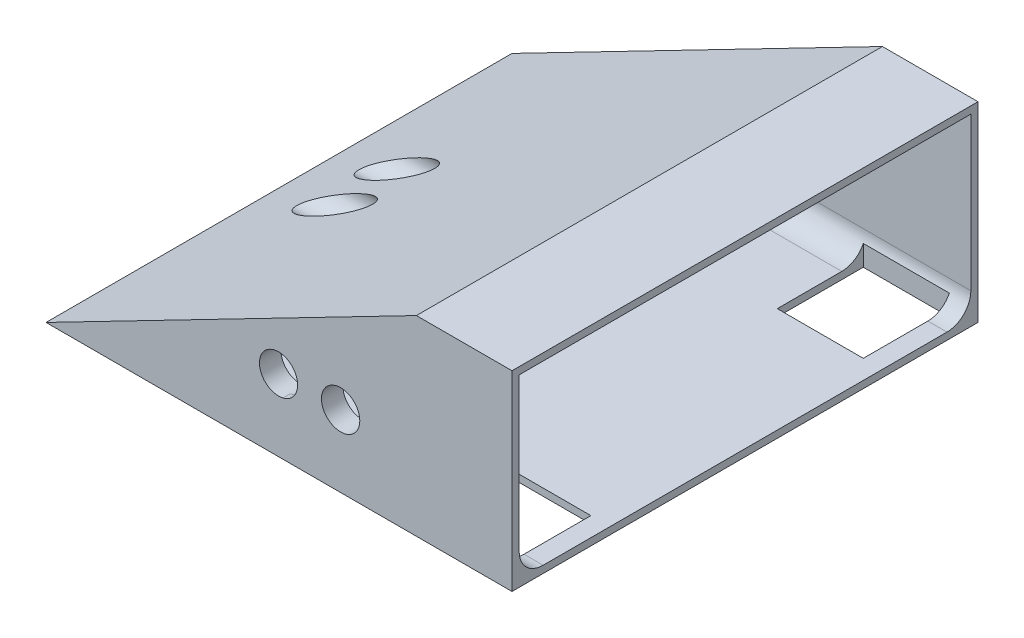
from build123d import *

# Parameters (mm, degrees)
ROBOT_DEPTH                 = 195
VACIO_POR_DENTRO_3MM_T      = -3
SKETCH3_R                   = 8.02
ULTRASONICO_DERECHA_DEPTH   = 3
SKETCH9_R                   = 8.2
ULTRASONICO_IZQUIERDA_DEPTH = 3
SKETCH10_W                  = 37
SKETCH10_H                  = 37
RUEDA_DERECHA_DEPTH         = 3
SKETCH12_W                  = 36
SKETCH12_H                  = 36
RUEDA_IZQUIERDA_DEPTH       = 3
SKETCH14_W                  = 7.1
SKETCH14_H                  = 7.1
CYN70_DERECHA_DEPTH         = 4
SKETCH15_W                  = 7.1
SKETCH15_H                  = 7.1
CNY70_CENTRO_DEPTH          = 4
SKETCH13_W                  = 7.1
SKETCH13_H                  = 7.1
CNY70_IZQUIERDA_DEPTH       = 4
ULTRASONICO_CENTRO_R        = 8.7
CUT_EXTRUDE4_DEPTH          = 75
FILLET2_R                   = 10
SKETCH16_R                  = 8.685660505
SKETCH16_R_2                = 8.02
BOSS_EXTRUDE1_DEPTH         = 9
SKETCH18_R                  = 8.7
SKETCH18_R_2                = 8.2
SKETCH18_R_3                = 8.719213476
BOSS_EXTRUDE2_DEPTH         = 60
SKETCH23_W                  = 76.592532913
SKETCH23_H                  = 65.967934853
CUT_EXTRUDE5_DEPTH          = 25


with BuildPart() as part:
    # Sketch2 → Robot (new body)
    with BuildSketch(Plane.XY):
        Polygon((0, 0), (195, 0), (195, 80), (155, 80), align=None)
    extrude(amount=ROBOT_DEPTH)

    # Vacio por dentro 3mm
    vacio_por_dentro_3mm_openings = [part.faces().sort_by_distance(p)[0] for p in [
        (195, 40, 97.5),
    ]]
    offset(amount=VACIO_POR_DENTRO_3MM_T, openings=vacio_por_dentro_3mm_openings, kind=Kind.INTERSECTION)

    # Sketch3 → Ultrasonico Derecha (cut)
    with BuildSketch(Plane.XY.offset(195)):
        with Locations((97.289863967, 30)):
            Circle(SKETCH3_R)
        with Locations((123.289863967, 30)):
            Circle(SKETCH3_R)
    extrude(amount=-ULTRASONICO_DERECHA_DEPTH, mode=Mode.SUBTRACT)

    # Sketch9 → Ultrasonico Izquierda (cut)
    with BuildSketch(Plane(origin=(0, 0, 0), x_dir=(-1, 0, 0), z_dir=(0, 0, -1))):
        with Locations((-97.284004153, 30)):
            Circle(SKETCH9_R)
        with Locations((-123.284004153, 30)):
            Circle(SKETCH9_R)
    extrude(amount=-ULTRASONICO_IZQUIERDA_DEPTH, mode=Mode.SUBTRACT)

    # Sketch10 → Rueda Derecha (cut)
    with BuildSketch(Plane(origin=(0, 0, 0), x_dir=(-1, 0, 0), z_dir=(0, -1, 0))):
        with Locations((-168.5, -172.5)):
            Rectangle(SKETCH10_W, SKETCH10_H)
    extrude(amount=-RUEDA_DERECHA_DEPTH, mode=Mode.SUBTRACT)

    # Sketch12 → Rueda Izquierda (cut)
    with BuildSketch(Plane(origin=(0, 0, 0), x_dir=(-1, 0, 0), z_dir=(0, -1, 0))):
        with Locations((-169, -22)):
            Rectangle(SKETCH12_W, SKETCH12_H)
    extrude(amount=-RUEDA_IZQUIERDA_DEPTH, mode=Mode.SUBTRACT)

    # Sketch14 → Cyn70 Derecha (cut)
    with BuildSketch(Plane(origin=(0, 0, 0), x_dir=(-1, 0, 0), z_dir=(0, -1, 0))):
        with Locations((-18.55, -183.45)):
            Rectangle(SKETCH14_W, SKETCH14_H)
    extrude(amount=-CYN70_DERECHA_DEPTH, mode=Mode.SUBTRACT)

    # Sketch15 → Cny70 Centro (cut)
    with BuildSketch(Plane(origin=(0, 0, 0), x_dir=(-1, 0, 0), z_dir=(0, -1, 0))):
        with Locations((-18.55, -97.5)):
            Rectangle(SKETCH15_W, SKETCH15_H)
    extrude(amount=-CNY70_CENTRO_DEPTH, mode=Mode.SUBTRACT)

    # Sketch13 → Cny70 Izquierda (cut)
    with BuildSketch(Plane.XZ):
        with Locations((18.55, 11.55)):
            Rectangle(SKETCH13_W, SKETCH13_H)
    extrude(amount=-CNY70_IZQUIERDA_DEPTH, mode=Mode.SUBTRACT)

    # Ultrasonico Centro → Cut-Extrude4 (cut)
    with BuildSketch(Plane(origin=(0, 0, 0), x_dir=(0, 0, -1), z_dir=(1, 0, 0))):
        with Locations(Location((-85, 19, 0), (0, 0, 270))):
            Circle(ULTRASONICO_CENTRO_R)
        with Locations(Location((-111, 19, 0), (0, 0, 270))):
            Circle(ULTRASONICO_CENTRO_R)
    extrude(amount=CUT_EXTRUDE4_DEPTH, mode=Mode.SUBTRACT)

    # Fillet2
    # the kernel refuses this fillet: 10 mm, written as the material it adds along each edge
    with BuildSketch(Plane(origin=(-12.646463672, 3, 3), x_dir=(0, 0, 1), z_dir=(1, 0, 0))) as fillet2_piece_1_section:
        with BuildLine():
            CenterArc((FILLET2_R, -FILLET2_R), FILLET2_R, 90, 90)
            Line((0, -FILLET2_R), (0, 0))
            Line((0, 0), (FILLET2_R, 0))
        make_face()
    fillet2_piece_1 = extrude(amount=232.646463672, mode=Mode.PRIVATE)
    fillet2_piece_1 = split(fillet2_piece_1, bisect_by=Plane(origin=(15, 3.299966987, 9.404706068), z_dir=(-1, 0, 0)), keep=Keep.TOP, mode=Mode.PRIVATE)
    fillet2_piece_1 = split(fillet2_piece_1, bisect_by=Plane(origin=(13.75014217, 3.720828822, 9.404706068), z_dir=(0.4586429197702524, -0.8886206570548638, 0)), keep=Keep.TOP, mode=Mode.PRIVATE)
    add(fillet2_piece_1)
    with BuildSketch(Plane(origin=(-12.646463672, 3, 3), x_dir=(0, 0, 1), z_dir=(1, 0, 0))) as fillet2_piece_2_section:
        with BuildLine():
            CenterArc((FILLET2_R, -FILLET2_R), FILLET2_R, 90, 90)
            Line((0, -FILLET2_R), (0, 0))
            Line((0, 0), (FILLET2_R, 0))
        make_face()
    fillet2_piece_2 = extrude(amount=232.646463672, mode=Mode.PRIVATE)
    fillet2_piece_2 = split(fillet2_piece_2, bisect_by=Plane(origin=(18.935979347, 4.386521826, 8), z_dir=(0, 0, -1)), keep=Keep.TOP, mode=Mode.PRIVATE)
    fillet2_piece_2 = split(fillet2_piece_2, bisect_by=Plane(origin=(151, 4.386521826, 5.724112509), z_dir=(-1, 0, 0)), keep=Keep.TOP, mode=Mode.PRIVATE)
    fillet2_piece_2 = split(fillet2_piece_2, bisect_by=Plane(origin=(18.116430796, 5.974397144, 5.724112509), z_dir=(0.4586429197702524, -0.8886206570548638, 0)), keep=Keep.TOP, mode=Mode.PRIVATE)
    add(fillet2_piece_2)
    with BuildSketch(Plane(origin=(-12.646463672, 3, 3), x_dir=(0, 0, 1), z_dir=(1, 0, 0))) as fillet2_piece_3_section:
        with BuildLine():
            CenterArc((FILLET2_R, -FILLET2_R), FILLET2_R, 90, 90)
            Line((0, -FILLET2_R), (0, 0))
            Line((0, 0), (FILLET2_R, 0))
        make_face()
    fillet2_piece_3 = extrude(amount=232.646463672, mode=Mode.PRIVATE)
    fillet2_piece_3 = split(fillet2_piece_3, bisect_by=Plane(origin=(22.1, 3.396845927, 9.232636126), z_dir=(1, 0, 0)), keep=Keep.TOP, mode=Mode.PRIVATE)
    fillet2_piece_3 = split(fillet2_piece_3, bisect_by=Plane(origin=(151, 3.396845927, 9.232636126), z_dir=(-1, 0, 0)), keep=Keep.TOP, mode=Mode.PRIVATE)
    fillet2_piece_3 = split(fillet2_piece_3, bisect_by=Plane(origin=(71.104265308, 33.322956893, 9.232636126), z_dir=(0.4586429197702524, -0.8886206570548638, 0)), keep=Keep.TOP, mode=Mode.PRIVATE)
    add(fillet2_piece_3)
    with BuildSketch(Plane(origin=(-12.646463672, 3, 3), x_dir=(0, 0, 1), z_dir=(1, 0, 0))) as fillet2_piece_4_section:
        with BuildLine():
            CenterArc((FILLET2_R, -FILLET2_R), FILLET2_R, 90, 90)
            Line((0, -FILLET2_R), (0, 0))
            Line((0, 0), (FILLET2_R, 0))
        make_face()
    fillet2_piece_4 = extrude(amount=207.646463672, mode=Mode.PRIVATE)
    fillet2_piece_4 = split(fillet2_piece_4, bisect_by=Plane(origin=(187, 3.396845927, 9.232636126), z_dir=(1, 0, 0)), keep=Keep.TOP, mode=Mode.PRIVATE)
    add(fillet2_piece_4)
    with BuildSketch(Plane(origin=(-12.646463672, 3, 3), x_dir=(0, 0, 1), z_dir=(1, 0, 0))) as fillet2_piece_5_section:
        with BuildLine():
            CenterArc((FILLET2_R, -FILLET2_R), FILLET2_R, 90, 90)
            Line((0, -FILLET2_R), (0, 0))
            Line((0, 0), (FILLET2_R, 0))
        make_face()
    fillet2_piece_5 = extrude(amount=232.646463672, mode=Mode.PRIVATE)
    fillet2_piece_5 = split(fillet2_piece_5, bisect_by=Plane(origin=(187, 6.605810426, 3.459165083), z_dir=(-1, 0, 0)), keep=Keep.TOP, mode=Mode.PRIVATE)
    fillet2_piece_5 = split(fillet2_piece_5, bisect_by=Plane(origin=(169, 6.605810426, 4), z_dir=(0, 0, -1)), keep=Keep.TOP, mode=Mode.PRIVATE)
    fillet2_piece_5 = split(fillet2_piece_5, bisect_by=Plane(origin=(137.518477626, 67.601260025, 3.459165083), z_dir=(0.4586429197702524, -0.8886206570548638, 0)), keep=Keep.TOP, mode=Mode.PRIVATE)
    add(fillet2_piece_5)
    with BuildSketch(Plane(origin=(-12.646463672, 3, 192), x_dir=(0, 0, -1), z_dir=(1, 0, 0))) as fillet2_piece_6_section:
        with BuildLine():
            CenterArc((FILLET2_R, FILLET2_R), FILLET2_R, 180, 90)
            Line((0, FILLET2_R), (0, 0))
            Line((0, 0), (FILLET2_R, 0))
        make_face()
    fillet2_piece_6 = extrude(amount=232.646463672, mode=Mode.PRIVATE)
    fillet2_piece_6 = split(fillet2_piece_6, bisect_by=Plane(origin=(15, 3.299966987, 185.595293932), z_dir=(-1, 0, 0)), keep=Keep.TOP, mode=Mode.PRIVATE)
    fillet2_piece_6 = split(fillet2_piece_6, bisect_by=Plane(origin=(13.75014217, 3.720828822, 185.595293932), z_dir=(0.4586429197702524, -0.8886206570548638, 0)), keep=Keep.TOP, mode=Mode.PRIVATE)
    add(fillet2_piece_6)
    with BuildSketch(Plane(origin=(-12.646463672, 3, 192), x_dir=(0, 0, -1), z_dir=(1, 0, 0))) as fillet2_piece_7_section:
        with BuildLine():
            CenterArc((FILLET2_R, FILLET2_R), FILLET2_R, 180, 90)
            Line((0, FILLET2_R), (0, 0))
            Line((0, 0), (FILLET2_R, 0))
        make_face()
    fillet2_piece_7 = extrude(amount=232.646463672, mode=Mode.PRIVATE)
    fillet2_piece_7 = split(fillet2_piece_7, bisect_by=Plane(origin=(18.935979347, 4.386521826, 187), z_dir=(0, 0, 1)), keep=Keep.TOP, mode=Mode.PRIVATE)
    fillet2_piece_7 = split(fillet2_piece_7, bisect_by=Plane(origin=(150, 4.386521826, 189.275887491), z_dir=(-1, 0, 0)), keep=Keep.TOP, mode=Mode.PRIVATE)
    fillet2_piece_7 = split(fillet2_piece_7, bisect_by=Plane(origin=(18.116430796, 5.974397144, 189.275887491), z_dir=(0.4586429197702524, -0.8886206570548638, 0)), keep=Keep.TOP, mode=Mode.PRIVATE)
    add(fillet2_piece_7)
    with BuildSketch(Plane(origin=(-12.646463672, 3, 192), x_dir=(0, 0, -1), z_dir=(1, 0, 0))) as fillet2_piece_8_section:
        with BuildLine():
            CenterArc((FILLET2_R, FILLET2_R), FILLET2_R, 180, 90)
            Line((0, FILLET2_R), (0, 0))
            Line((0, 0), (FILLET2_R, 0))
        make_face()
    fillet2_piece_8 = extrude(amount=232.646463672, mode=Mode.PRIVATE)
    fillet2_piece_8 = split(fillet2_piece_8, bisect_by=Plane(origin=(22.1, 3.396845927, 185.767363874), z_dir=(1, 0, 0)), keep=Keep.TOP, mode=Mode.PRIVATE)
    fillet2_piece_8 = split(fillet2_piece_8, bisect_by=Plane(origin=(150, 3.396845927, 185.767363874), z_dir=(-1, 0, 0)), keep=Keep.TOP, mode=Mode.PRIVATE)
    fillet2_piece_8 = split(fillet2_piece_8, bisect_by=Plane(origin=(70.709441972, 33.119177106, 185.767363874), z_dir=(0.4586429197702524, -0.8886206570548638, 0)), keep=Keep.TOP, mode=Mode.PRIVATE)
    add(fillet2_piece_8)
    with BuildSketch(Plane(origin=(-12.646463672, 3, 192), x_dir=(0, 0, -1), z_dir=(1, 0, 0))) as fillet2_piece_9_section:
        with BuildLine():
            CenterArc((FILLET2_R, FILLET2_R), FILLET2_R, 180, 90)
            Line((0, FILLET2_R), (0, 0))
            Line((0, 0), (FILLET2_R, 0))
        make_face()
    fillet2_piece_9 = extrude(amount=207.646463672, mode=Mode.PRIVATE)
    fillet2_piece_9 = split(fillet2_piece_9, bisect_by=Plane(origin=(187, 3.396845927, 185.767363874), z_dir=(1, 0, 0)), keep=Keep.TOP, mode=Mode.PRIVATE)
    add(fillet2_piece_9)
    with BuildSketch(Plane(origin=(-12.646463672, 3, 192), x_dir=(0, 0, -1), z_dir=(1, 0, 0))) as fillet2_piece_10_section:
        with BuildLine():
            CenterArc((FILLET2_R, FILLET2_R), FILLET2_R, 180, 90)
            Line((0, FILLET2_R), (0, 0))
            Line((0, 0), (FILLET2_R, 0))
        make_face()
    fillet2_piece_10 = extrude(amount=232.646463672, mode=Mode.PRIVATE)
    fillet2_piece_10 = split(fillet2_piece_10, bisect_by=Plane(origin=(187, 6.605810426, 191.540834917), z_dir=(-1, 0, 0)), keep=Keep.TOP, mode=Mode.PRIVATE)
    fillet2_piece_10 = split(fillet2_piece_10, bisect_by=Plane(origin=(168.5, 6.605810426, 191), z_dir=(0, 0, 1)), keep=Keep.TOP, mode=Mode.PRIVATE)
    fillet2_piece_10 = split(fillet2_piece_10, bisect_by=Plane(origin=(137.12365429, 67.397480238, 191.540834917), z_dir=(0.4586429197702524, -0.8886206570548638, 0)), keep=Keep.TOP, mode=Mode.PRIVATE)
    add(fillet2_piece_10)

    # Sketch16 → Boss-Extrude1 (add)
    # profile 1 of 2: a face of its own
    with BuildSketch(Plane.XY.offset(195)):
        with Locations((123.289863967, 30)):
            Circle(SKETCH16_R)
        with Locations((123.289863967, 30)):
            Circle(SKETCH16_R_2, mode=Mode.SUBTRACT)
    # profile 2 of 2: a face of its own
    with BuildSketch(Plane.XY.offset(195)):
        with Locations((97.335124092, 30.010684101)):
            Circle(SKETCH16_R)
        with Locations((97.335124092, 30.010684101)):
            Circle(SKETCH16_R_2, mode=Mode.SUBTRACT)
    boss_extrude1 = extrude(amount=-BOSS_EXTRUDE1_DEPTH)

    # Mirror1: Boss-Extrude1 across plane
    add(boss_extrude1.mirror(Plane.XY.offset(97.5)))

    # Sketch18 → Boss-Extrude2 (add)
    # profile 1 of 2: a face of its own
    with BuildSketch(Plane(origin=(1, 0, 0), x_dir=(0, 0, -1), z_dir=(1, 0, 0))):
        with Locations(Location((-85, 19, 0), (0, 0, 270))):
            Circle(SKETCH18_R)
        with Locations((-85, 19)):
            Circle(SKETCH18_R_2, mode=Mode.SUBTRACT)
    # profile 2 of 2: a face of its own
    with BuildSketch(Plane(origin=(1, 0, 0), x_dir=(0, 0, -1), z_dir=(1, 0, 0))):
        with Locations(Location((-111, 19, 0), (0, 0, 270))):
            Circle(SKETCH18_R_3)
        with Locations((-111, 19)):
            Circle(SKETCH18_R_2, mode=Mode.SUBTRACT)
    extrude(amount=BOSS_EXTRUDE2_DEPTH)

    # Sketch23 → Cut-Extrude5 (cut)
    with BuildSketch(Plane(origin=(0, 0, 0), x_dir=(0.8886206570548638, 0.45864291977025234, 0), z_dir=(-0.4586429197702524, 0.8886206570548639, 0))):
        with Locations((38.296266456, -97.30278137)):
            Rectangle(SKETCH23_W, SKETCH23_H)
    extrude(amount=CUT_EXTRUDE5_DEPTH, mode=Mode.SUBTRACT)


solid = part.part
